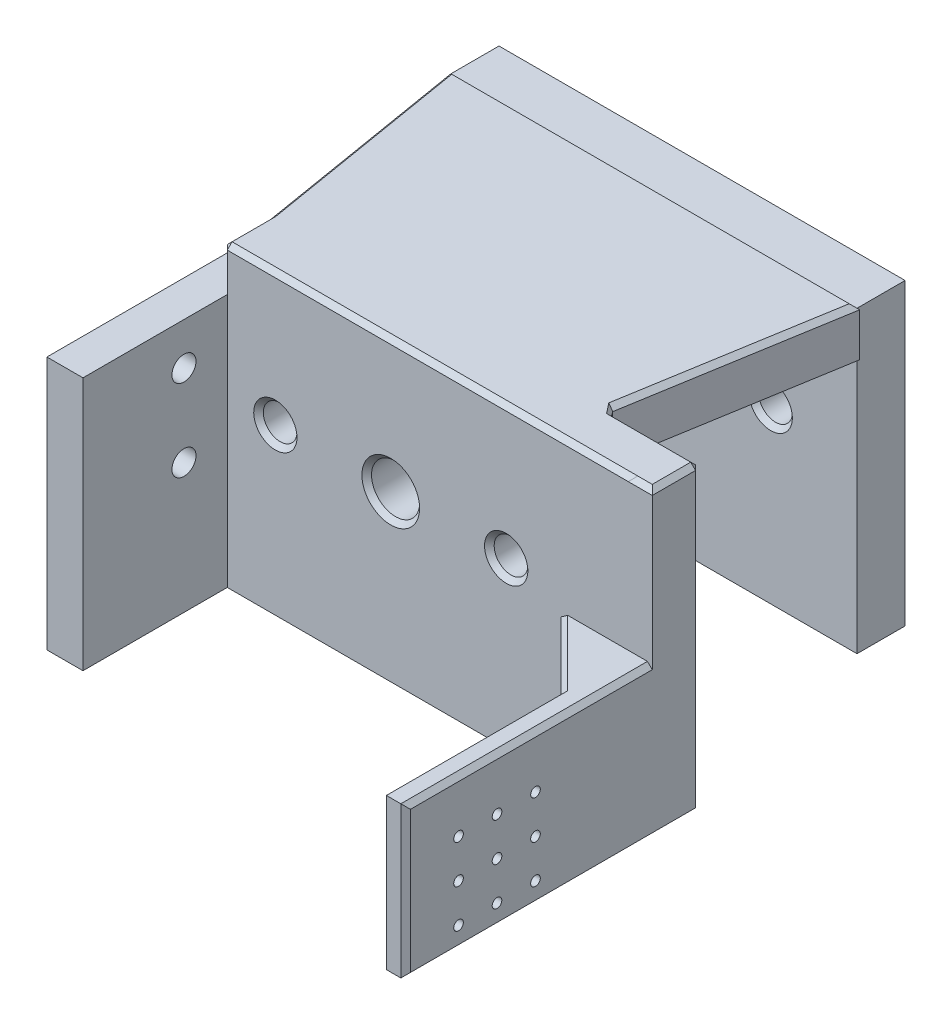
from build123d import *
from OCP.BRepFilletAPI import BRepFilletAPI_MakeChamfer

# Parameters (mm, degrees)
SKETCH1_W                = 70
SKETCH1_H                = 62.75
BOSS_EXTRUDE1_DEPTH      = 10
SKETCH2_R                = 5
CUT_EXTRUDE1_DEPTH       = 95.538682559
SKETCH3_R                = 3.5
CUT_EXTRUDE2_DEPTH       = 95.538682559
BOSS_EXTRUDE2_DEPTH      = 10
SKETCH5_W                = 35
SKETCH5_H                = 6.5
CUT_EXTRUDE3_DEPTH       = 45
CHAMFER1_SIZE            = 1
CHAMFER2_SIZE            = 6
SKETCH6_W                = 10
SKETCH6_H                = 62.75
BOSS_EXTRUDE3_DEPTH      = 19.37
SKETCH7_W                = 5
SKETCH7_H                = 62.75
BOSS_EXTRUDE4_DEPTH      = 51.28
CUT_EXTRUDE4_REACH       = 132.677
SKETCH8_R                = 1
CHAMFER3_SIZE            = 1
CHAMFER3_SIZE2           = 0.868966076
CUT_EXTRUDE5_REACH       = 129.015
SKETCH9_W                = 51.28
SKETCH9_H                = 31.375
CHAMFER4_SIZE            = 1
CHAMFER5_SIZE            = 1
SKETCH11_W               = 5
SKETCH11_H               = 20
CUT_EXTRUDE6_DEPTH       = 10
BOSS_EXTRUDE5_DEPTH      = 5
BOSS_EXTRUDE6_DEPTH      = 3
CHAMFER6_SIZE            = 1
BOSS_EXTRUDE7_DEPTH      = 7.5
BOSS_EXTRUDE7_DEPTH_BACK = 3
SKETCH14_W               = 74
SKETCH14_H               = 52.75
SKETCH16_W               = 84.440102638
SKETCH16_H               = 62.216003031
BOSS_EXTRUDE8_DEPTH      = 10
CUT_EXTRUDE8_REACH       = 161.517
SKETCH17_R               = 3.5
SKETCH17_R_2             = 5
CHAMFER7_SIZE            = 1
SKETCH18_W               = 7.5
SKETCH18_H               = 52.75
BOSS_EXTRUDE11_DEPTH     = 30
SKETCH19_W               = 10.5
SKETCH19_H               = 52.75
CUT_EXTRUDE9_DEPTH       = 10
CUT_EXTRUDE10_REACH      = 125.096
SKETCH20_R               = 2.5


with BuildPart() as part:
    # Sketch1 → Boss-Extrude1 (new body)
    with BuildSketch(Plane.XY):
        with Locations((35, 31.375)):
            Rectangle(SKETCH1_W, SKETCH1_H)
    extrude(amount=BOSS_EXTRUDE1_DEPTH)

    # Sketch2 → Cut-Extrude1 (cut, through all)
    with BuildSketch(Plane.XY.offset(10)):
        with Locations((35, 35.25)):
            Circle(SKETCH2_R)
    extrude(amount=-CUT_EXTRUDE1_DEPTH, mode=Mode.SUBTRACT)

    # Sketch3 → Cut-Extrude2 (cut, through all)
    with BuildSketch(Plane.XY.offset(10)):
        with Locations((11, 35.25)):
            Circle(SKETCH3_R)
        with Locations((59, 35.25)):
            Circle(SKETCH3_R)
    extrude(amount=-CUT_EXTRUDE2_DEPTH, mode=Mode.SUBTRACT)

    # Sketch4 → Boss-Extrude2 (add)
    with BuildSketch(Plane(origin=(0, 62.75, 0), x_dir=(1, 0, 0), z_dir=(0, 1, 0))):
        Polygon((0, 0), (-7.5, 45), (77.5, 45), (70, 0), align=None)
    extrude(amount=-BOSS_EXTRUDE2_DEPTH)

    # Sketch5 → Cut-Extrude3 (cut)
    with BuildSketch(Plane(origin=(0, 0, -45), x_dir=(-1, 0, 0), z_dir=(0, 0, -1))):
        with Locations((-35, 56)):
            Rectangle(SKETCH5_W, SKETCH5_H)
    extrude(amount=-CUT_EXTRUDE3_DEPTH, mode=Mode.SUBTRACT)

    # Chamfer1
    chamfer1_edges = [part.edges().sort_by_distance(p)[0] for p in [
        (30, 35.25, 0),
        (30, 35.25, 10),
        (7.5, 35.25, 0),
        (7.5, 35.25, 10),
        (55.5, 35.25, 0),
        (55.5, 35.25, 10),
    ]]
    chamfer(chamfer1_edges, length=CHAMFER1_SIZE)

    # Chamfer2
    chamfer2_edges = [part.edges().sort_by_distance(p)[0] for p in [
        (52.5, 52.75, -22.5),
        (17.5, 52.75, -22.5),
    ]]
    chamfer(chamfer2_edges, length=CHAMFER2_SIZE)

    # Sketch6 → Boss-Extrude3 (add)
    with BuildSketch(Plane(origin=(70, 0, 0), x_dir=(0, 0, -1), z_dir=(1, 0, 0))):
        with Locations((-5, 31.375)):
            Rectangle(SKETCH6_W, SKETCH6_H)
    extrude(amount=BOSS_EXTRUDE3_DEPTH)

    # Sketch7 → Boss-Extrude4 (add)
    with BuildSketch(Plane.XY.offset(10)):
        with Locations((86.87, 31.375)):
            Rectangle(SKETCH7_W, SKETCH7_H)
    extrude(amount=BOSS_EXTRUDE4_DEPTH)

    # Sketch8 → Cut-Extrude4 (cut, up to next)
    with BuildSketch(Plane(origin=(89.37, 0, 0), x_dir=(0, 0, -1), z_dir=(1, 0, 0)), mode=Mode.PRIVATE) as cut_extrude4_sk1:
        with Locations((-34.28, 20.5)):
            Circle(SKETCH8_R)
    cut_extrude4_tool1 = extrude(cut_extrude4_sk1.sketch, amount=-CUT_EXTRUDE4_REACH, mode=Mode.PRIVATE) & part.part
    # Sketch8 → Cut-Extrude4 (cut, up to next)
    with BuildSketch(Plane(origin=(89.37, 0, 0), x_dir=(0, 0, -1), z_dir=(1, 0, 0)), mode=Mode.PRIVATE) as cut_extrude4_sk2:
        with Locations((-42.28, 20.5)):
            Circle(SKETCH8_R)
    cut_extrude4_tool2 = extrude(cut_extrude4_sk2.sketch, amount=-CUT_EXTRUDE4_REACH, mode=Mode.PRIVATE) & part.part
    # Sketch8 → Cut-Extrude4 (cut, up to next)
    with BuildSketch(Plane(origin=(89.37, 0, 0), x_dir=(0, 0, -1), z_dir=(1, 0, 0)), mode=Mode.PRIVATE) as cut_extrude4_sk3:
        with Locations((-50.28, 12.5)):
            Circle(SKETCH8_R)
    cut_extrude4_tool3 = extrude(cut_extrude4_sk3.sketch, amount=-CUT_EXTRUDE4_REACH, mode=Mode.PRIVATE) & part.part
    # Sketch8 → Cut-Extrude4 (cut, up to next)
    with BuildSketch(Plane(origin=(89.37, 0, 0), x_dir=(0, 0, -1), z_dir=(1, 0, 0)), mode=Mode.PRIVATE) as cut_extrude4_sk4:
        with Locations((-42.279999441, 12.5)):
            Circle(SKETCH8_R)
    cut_extrude4_tool4 = extrude(cut_extrude4_sk4.sketch, amount=-CUT_EXTRUDE4_REACH, mode=Mode.PRIVATE) & part.part
    # Sketch8 → Cut-Extrude4 (cut, up to next)
    with BuildSketch(Plane(origin=(89.37, 0, 0), x_dir=(0, 0, -1), z_dir=(1, 0, 0)), mode=Mode.PRIVATE) as cut_extrude4_sk5:
        with Locations((-34.279998882, 12.5)):
            Circle(SKETCH8_R)
    cut_extrude4_tool5 = extrude(cut_extrude4_sk5.sketch, amount=-CUT_EXTRUDE4_REACH, mode=Mode.PRIVATE) & part.part
    # Sketch8 → Cut-Extrude4 (cut, up to next)
    with BuildSketch(Plane(origin=(89.37, 0, 0), x_dir=(0, 0, -1), z_dir=(1, 0, 0)), mode=Mode.PRIVATE) as cut_extrude4_sk6:
        with Locations((-34.279998882, 4.5)):
            Circle(SKETCH8_R)
    cut_extrude4_tool6 = extrude(cut_extrude4_sk6.sketch, amount=-CUT_EXTRUDE4_REACH, mode=Mode.PRIVATE) & part.part
    # Sketch8 → Cut-Extrude4 (cut, up to next)
    with BuildSketch(Plane(origin=(89.37, 0, 0), x_dir=(0, 0, -1), z_dir=(1, 0, 0)), mode=Mode.PRIVATE) as cut_extrude4_sk7:
        with Locations((-42.279999441, 4.5)):
            Circle(SKETCH8_R)
    cut_extrude4_tool7 = extrude(cut_extrude4_sk7.sketch, amount=-CUT_EXTRUDE4_REACH, mode=Mode.PRIVATE) & part.part
    # Sketch8 → Cut-Extrude4 (cut, up to next)
    with BuildSketch(Plane(origin=(89.37, 0, 0), x_dir=(0, 0, -1), z_dir=(1, 0, 0)), mode=Mode.PRIVATE) as cut_extrude4_sk8:
        with Locations((-50.28, 20.5)):
            Circle(SKETCH8_R)
    cut_extrude4_tool8 = extrude(cut_extrude4_sk8.sketch, amount=-CUT_EXTRUDE4_REACH, mode=Mode.PRIVATE) & part.part
    # Sketch8 → Cut-Extrude4 (cut, up to next)
    with BuildSketch(Plane(origin=(89.37, 0, 0), x_dir=(0, 0, -1), z_dir=(1, 0, 0)), mode=Mode.PRIVATE) as cut_extrude4_sk9:
        with Locations((-50.28, 4.5)):
            Circle(SKETCH8_R)
    cut_extrude4_tool9 = extrude(cut_extrude4_sk9.sketch, amount=-CUT_EXTRUDE4_REACH, mode=Mode.PRIVATE) & part.part
    add(cut_extrude4_tool1.solids().sort_by_distance((89.37, 20.5, 34.28))[0], mode=Mode.SUBTRACT)
    add(cut_extrude4_tool2.solids().sort_by_distance((89.37, 20.5, 42.28))[0], mode=Mode.SUBTRACT)
    add(cut_extrude4_tool3.solids().sort_by_distance((89.37, 12.5, 50.28))[0], mode=Mode.SUBTRACT)
    add(cut_extrude4_tool4.solids().sort_by_distance((89.37, 12.5, 42.279999))[0], mode=Mode.SUBTRACT)
    add(cut_extrude4_tool5.solids().sort_by_distance((89.37, 12.5, 34.279999))[0], mode=Mode.SUBTRACT)
    add(cut_extrude4_tool6.solids().sort_by_distance((89.37, 4.5, 34.279999))[0], mode=Mode.SUBTRACT)
    add(cut_extrude4_tool7.solids().sort_by_distance((89.37, 4.5, 42.279999))[0], mode=Mode.SUBTRACT)
    add(cut_extrude4_tool8.solids().sort_by_distance((89.37, 20.5, 50.28))[0], mode=Mode.SUBTRACT)
    add(cut_extrude4_tool9.solids().sort_by_distance((89.37, 4.5, 50.28))[0], mode=Mode.SUBTRACT)

    # Chamfer3: one chamfer whose edges measure the first distance from different faces: ONE call of the kernel's chamfer builder (chamfer() names one face for all edges)
    chamfer3_edges_1 = [part.edges().sort_by_distance(p)[0] for p in [
        (70, 57.75, 0),
    ]]
    chamfer3_side_1 = [part.faces().sort_by_distance(p)[0] for p in [
        (73.75, 57.75, -22.5),
    ]]
    chamfer3_edges_2 = [part.edges().sort_by_distance(p)[0] for p in [
        (0, 26.375, 0),
        (89.37, 31.375, 0),
        (89.37, 31.375, 61.28),
        (89.37, 62.75, 30.64),
        (79.685, 62.75, 0),
        (73.75, 62.75, -22.5),
        (35, 62.75, -45),
        (-3.75, 62.75, -22.5),
        (0, 62.75, 5),
        (84.37, 31.375, 61.28),
        (84.37, 0, 35.64),
        (84.37, 62.75, 35.64),
        (42.185, 62.75, 10),
        (42.185, 0, 10),
        (0, 31.375, 10),
    ]]
    chamfer3 = BRepFilletAPI_MakeChamfer(part.part.solid().wrapped)
    for e in chamfer3_edges_1:
        chamfer3.Add(CHAMFER3_SIZE, CHAMFER3_SIZE2, e.wrapped, chamfer3_side_1[0].wrapped)  # the first distance lies on this face
    for e in chamfer3_edges_2:
        chamfer3.Add(CHAMFER3_SIZE, e.wrapped)
    add(Compound.cast(chamfer3.Shape()), mode=Mode.REPLACE)

    # Sketch9 → Cut-Extrude5 (cut, up to next)
    with BuildSketch(Plane.ZY.offset(-84.37), mode=Mode.PRIVATE) as cut_extrude5_sk1:
        with Locations((35.64, 47.0625)):
            Rectangle(SKETCH9_W, SKETCH9_H)
    cut_extrude5_tool1 = extrude(cut_extrude5_sk1.sketch, amount=-CUT_EXTRUDE5_REACH, mode=Mode.PRIVATE) & part.part
    add(cut_extrude5_tool1.solids().sort_by_distance((84.37, 47.0625, 35.64))[0], mode=Mode.SUBTRACT)

    # Chamfer4
    chamfer4_edges = [part.edges().sort_by_distance(p)[0] for p in [
        (86.87, 62.75, 10),
    ]]
    chamfer(chamfer4_edges, length=CHAMFER4_SIZE - 0.0001)  # a hair under: the kernel refuses the full size

    # Chamfer5
    chamfer5_edges = [part.edges().sort_by_distance(p)[0] for p in [
        (84.37, 31.375, 35.14),
        (89.37, 31.375, 35.14),
    ]]
    chamfer(chamfer5_edges, length=CHAMFER5_SIZE)

    # Sketch11 → Cut-Extrude6 (cut)
    with BuildSketch(Plane(origin=(0, 0, 0), x_dir=(-1, 0, 0), z_dir=(0, 0, -1))):
        with Locations((-79.37, 13)):
            Rectangle(SKETCH11_W, SKETCH11_H)
    extrude(amount=-CUT_EXTRUDE6_DEPTH, mode=Mode.SUBTRACT)

    # Sketch12 → Boss-Extrude5 (add)
    with BuildSketch(Plane(origin=(0, 31.375, 0), x_dir=(1, 0, 0), z_dir=(0, 1, 0))):
        Polygon((85.37, -25), (70.37, -10), (85.37, -10), align=None)
    extrude(amount=-BOSS_EXTRUDE5_DEPTH)

    # Sketch13 → Boss-Extrude6 (add)
    with BuildSketch(Plane.XZ):
        Polygon((85.37, 24), (70.37, 9), (85.37, 9), align=None)
    extrude(amount=-BOSS_EXTRUDE6_DEPTH)

    # Chamfer6
    chamfer6_edges = [part.edges().sort_by_distance(p)[0] for p in [
        (89.37, 0, 30.64),
        (77.87, 0, 16.5),
        (77.87, 3, 16.5),
        (77.37, 26.375, 17),
        (77.87, 31.375, 17.5),
    ]]
    chamfer(chamfer6_edges, length=CHAMFER6_SIZE)

    # Sketch14 → Boss-Extrude7 (add, two sides: drawn at the far end of the back side and taken through both)
    with BuildSketch(Plane.ZY.offset(-BOSS_EXTRUDE7_DEPTH_BACK)):
        with Locations((-28, 26.375)):
            Rectangle(SKETCH14_W, SKETCH14_H)
    extrude(amount=BOSS_EXTRUDE7_DEPTH + BOSS_EXTRUDE7_DEPTH_BACK)

    # Sketch16 → Boss-Extrude8 (add)
    with BuildSketch(Plane(origin=(0, 0, -45), x_dir=(-1, 0, 0), z_dir=(0, 0, -1))):
        with Locations((-34.720051319, 30.641998485)):
            Rectangle(SKETCH16_W, SKETCH16_H)
    extrude(amount=BOSS_EXTRUDE8_DEPTH)

    # Sketch17 → Cut-Extrude8 (cut, up to next)
    with BuildSketch(Plane(origin=(0, 0, -55), x_dir=(-1, 0, 0), z_dir=(0, 0, -1)), mode=Mode.PRIVATE) as cut_extrude8_sk1:
        with Locations((-11, 35.25)):
            Circle(SKETCH17_R)
    cut_extrude8_tool1 = extrude(cut_extrude8_sk1.sketch, amount=-CUT_EXTRUDE8_REACH, mode=Mode.PRIVATE) & part.part
    # Sketch17 → Cut-Extrude8 (cut, up to next)
    with BuildSketch(Plane(origin=(0, 0, -55), x_dir=(-1, 0, 0), z_dir=(0, 0, -1)), mode=Mode.PRIVATE) as cut_extrude8_sk2:
        with Locations((-35, 35.25)):
            Circle(SKETCH17_R_2)
    cut_extrude8_tool2 = extrude(cut_extrude8_sk2.sketch, amount=-CUT_EXTRUDE8_REACH, mode=Mode.PRIVATE) & part.part
    # Sketch17 → Cut-Extrude8 (cut, up to next)
    with BuildSketch(Plane(origin=(0, 0, -55), x_dir=(-1, 0, 0), z_dir=(0, 0, -1)), mode=Mode.PRIVATE) as cut_extrude8_sk3:
        with Locations((-59, 35.25)):
            Circle(SKETCH17_R)
    cut_extrude8_tool3 = extrude(cut_extrude8_sk3.sketch, amount=-CUT_EXTRUDE8_REACH, mode=Mode.PRIVATE) & part.part
    add(cut_extrude8_tool1.solids().sort_by_distance((11, 35.25, -55))[0], mode=Mode.SUBTRACT)
    add(cut_extrude8_tool2.solids().sort_by_distance((35, 35.25, -55))[0], mode=Mode.SUBTRACT)
    add(cut_extrude8_tool3.solids().sort_by_distance((59, 35.25, -55))[0], mode=Mode.SUBTRACT)

    # Chamfer7
    chamfer7_edges = [part.edges().sort_by_distance(p)[0] for p in [
        (14.5, 35.25, -45),
        (14.5, 35.25, -55),
        (40, 35.25, -45),
        (40, 35.25, -55),
        (62.5, 35.25, -45),
        (62.5, 35.25, -55),
    ]]
    chamfer(chamfer7_edges, length=CHAMFER7_SIZE)

    # Sketch18 → Boss-Extrude11 (add)
    with BuildSketch(Plane.XY.offset(9)):
        with Locations((-3.75, 26.375)):
            Rectangle(SKETCH18_W, SKETCH18_H)
    extrude(amount=BOSS_EXTRUDE11_DEPTH)

    # Sketch19 → Cut-Extrude9 (cut)
    with BuildSketch(Plane(origin=(0, 0, -65), x_dir=(-1, 0, 0), z_dir=(0, 0, -1))):
        with Locations((2.25, 26.375)):
            Rectangle(SKETCH19_W, SKETCH19_H)
    extrude(amount=-CUT_EXTRUDE9_DEPTH, mode=Mode.SUBTRACT)

    # Sketch20 → Cut-Extrude10 (cut, up to next)
    with BuildSketch(Plane(origin=(3, 0, 0), x_dir=(0, 0, -1), z_dir=(1, 0, 0)), mode=Mode.PRIVATE) as cut_extrude10_sk1:
        with Locations((10, 44)):
            Circle(SKETCH20_R)
    cut_extrude10_tool1 = extrude(cut_extrude10_sk1.sketch, amount=-CUT_EXTRUDE10_REACH, mode=Mode.PRIVATE) & part.part
    # Sketch20 → Cut-Extrude10 (cut, up to next)
    with BuildSketch(Plane(origin=(3, 0, 0), x_dir=(0, 0, -1), z_dir=(1, 0, 0)), mode=Mode.PRIVATE) as cut_extrude10_sk2:
        with Locations((-18, 44)):
            Circle(SKETCH20_R)
    cut_extrude10_tool2 = extrude(cut_extrude10_sk2.sketch, amount=-CUT_EXTRUDE10_REACH, mode=Mode.PRIVATE) & part.part
    # Sketch20 → Cut-Extrude10 (cut, up to next)
    with BuildSketch(Plane(origin=(3, 0, 0), x_dir=(0, 0, -1), z_dir=(1, 0, 0)), mode=Mode.PRIVATE) as cut_extrude10_sk3:
        with Locations((-18, 27)):
            Circle(SKETCH20_R)
    cut_extrude10_tool3 = extrude(cut_extrude10_sk3.sketch, amount=-CUT_EXTRUDE10_REACH, mode=Mode.PRIVATE) & part.part
    # Sketch20 → Cut-Extrude10 (cut, up to next)
    with BuildSketch(Plane(origin=(3, 0, 0), x_dir=(0, 0, -1), z_dir=(1, 0, 0)), mode=Mode.PRIVATE) as cut_extrude10_sk4:
        with Locations((10, 27)):
            Circle(SKETCH20_R)
    cut_extrude10_tool4 = extrude(cut_extrude10_sk4.sketch, amount=-CUT_EXTRUDE10_REACH, mode=Mode.PRIVATE) & part.part
    add(cut_extrude10_tool1.solids().sort_by_distance((3, 44, -10))[0], mode=Mode.SUBTRACT)
    add(cut_extrude10_tool2.solids().sort_by_distance((3, 44, 18))[0], mode=Mode.SUBTRACT)
    add(cut_extrude10_tool3.solids().sort_by_distance((3, 27, 18))[0], mode=Mode.SUBTRACT)
    add(cut_extrude10_tool4.solids().sort_by_distance((3, 27, -10))[0], mode=Mode.SUBTRACT)


solid = part.part
